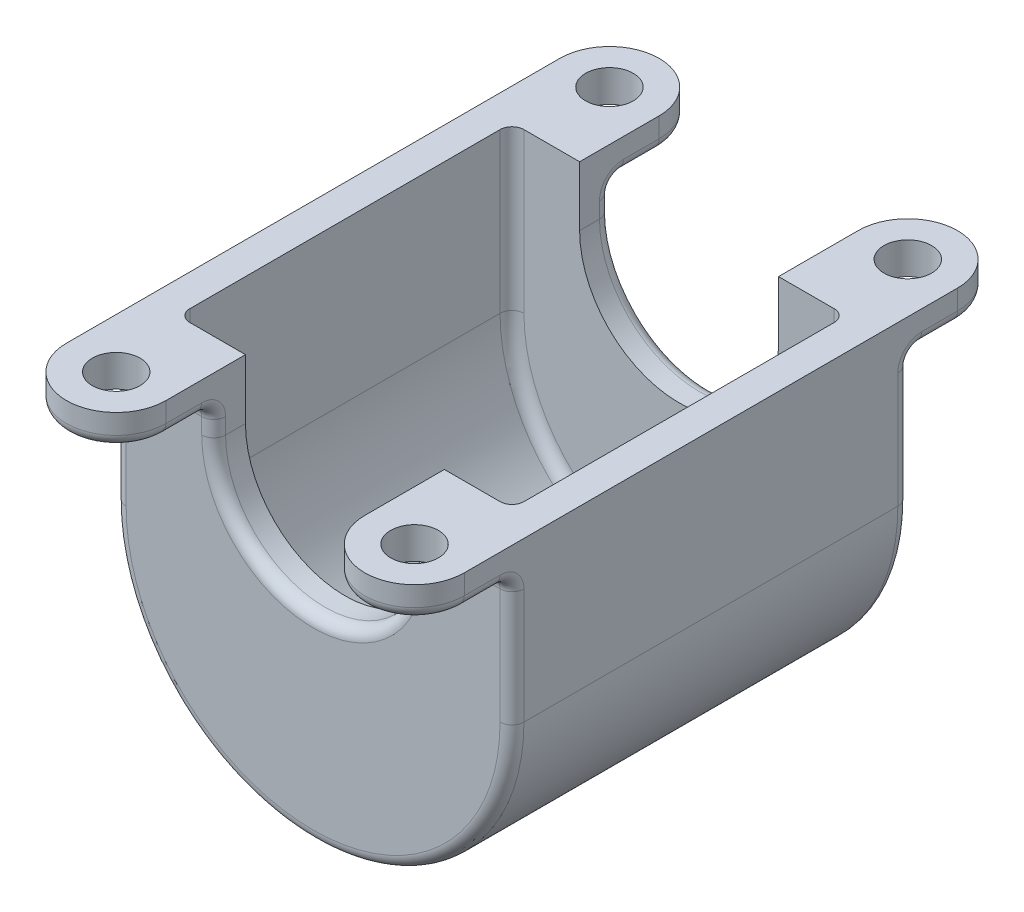
from build123d import *

# Parameters (mm, degrees)
BASE_EXTRUDE_DEPTH  = 50
SHELL1_DEPTH        = 42
SKETCH2_R           = 6
BOSS_EXTRUDE1_DEPTH = 8
FILLET1_R           = 3
FILLET2_R           = 3


# Read off the part's stored shape, not the designer's step: Shell1
with BuildPart() as part:
    # Sketch1 → Base-Extrude (new body)
    with BuildSketch(Plane.XY):
        with BuildLine():
            Line((50, 0), (25, 0))
            Line((25, 0), (25, -15))
            ThreePointArc((25, -15), (0, -40), (-25, -15))
            Line((-25, -15), (-25, 0))
            Line((-25, 0), (-50, 0))
            Line((-50, 0), (-50, -40))
            ThreePointArc((-50, -40), (0, -90), (50, -40))
            Line((50, -40), (50, 0))
        make_face()
    extrude(amount=BASE_EXTRUDE_DEPTH)

    # Shell1 outline → Shell1 (cut)
    with BuildSketch(Plane.XY):
        with BuildLine():
            Line((-42, 0), (-42, -40))
            ThreePointArc((-42, -40), (0, -82), (42, -40))
            Line((42, -40), (42, 0))
            Line((42, 0), (25, 0))
            Line((25, 0), (25, -15))
            ThreePointArc((25, -15), (0, -40), (-25, -15))
            Line((-25, -15), (-25, 0))
            Line((-25, 0), (-42, 0))
        make_face()
    extrude(amount=SHELL1_DEPTH, mode=Mode.SUBTRACT)

    # Sketch2 → Boss-Extrude1 (add)
    with BuildSketch(Plane(origin=(0, 0, 0), x_dir=(-1, 0, 0), z_dir=(0, 1, 0))):
        with BuildLine():
            Line((25, 42), (50, 42))
            Line((50, 42), (50, 62))
            ThreePointArc((50, 62), (37.5, 74.5), (25, 62))
            Line((25, 62), (25, 42))
        make_face()
        with Locations((37.5, 62)):
            Circle(SKETCH2_R, mode=Mode.SUBTRACT)
    boss_extrude1 = extrude(amount=-BOSS_EXTRUDE1_DEPTH)

    # Mirror1: Boss-Extrude1 across plane
    add(boss_extrude1.mirror(Plane(origin=(0, 0, 0), x_dir=(0, 0, 1), z_dir=(1, 0, 0))))

    # Boss-Mirror1: part across face


with BuildPart() as part_1:
    add(part.part)
    add(part.part.mirror(Plane(origin=(0, -51.77064839, 0), x_dir=(1, 0, 0), z_dir=(0, 0, -1))))

    # Fillet1
    fillet1_edges = [part_1.edges().sort_by_distance(p)[0] for p in [
        (42, -20, -42),
        (-42, -20, -42),
        (0, -82, -42),
        (-37.5, -8, -50),
        (37.5, -8, -50),
        (42, -20, 42),
        (-42, -20, 42),
        (0, -82, 42),
        (-37.5, -8, 50),
        (37.5, -8, 50),
    ]]
    fillet(fillet1_edges, radius=FILLET1_R)

    # Fillet2
    fillet2_edges = [part_1.edges().sort_by_distance(p)[0] for p in [
        (0, -90, 50),
        (-37.5, -8, -74.5),
        (50, -8, -57.5),
        (37.5, -8, -74.5),
        (50, -25.5, 50),
        (25, -13, 50),
        (-25, -13, 50),
        (-50, -25.5, 50),
        (25, -8, 57.5),
        (-25, -8, 57.5),
        (25, -8, -57.5),
        (50, -25.5, -50),
        (-50, -25.5, -50),
        (-25, -13, -50),
        (25, -13, -50),
        (-25, -8, -57.5),
        (25, -8.878679656, 50.878679656),
        (50, -8.878679656, 50.878679656),
        (-50, -8.878679656, 50.878679656),
        (-25, -8.878679656, 50.878679656),
        (25, -8.878679656, -50.878679656),
        (50, -8.878679656, -50.878679656),
        (-50, -8.878679656, -50.878679656),
        (-25, -8.878679656, -50.878679656),
        (0, -40, 50),
        (-37.5, -8, 74.5),
        (-50, -8, 57.5),
        (37.5, -8, 74.5),
        (50, -8, 57.5),
        (0, -40, -50),
        (-50, -8, -57.5),
        (0, -90, -50),
    ]]
    fillet(fillet2_edges, radius=FILLET2_R)


solid = part_1.part
